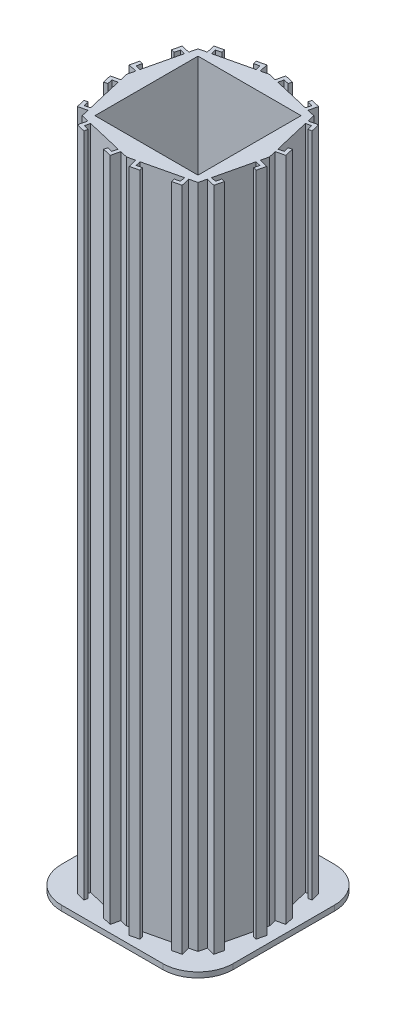
from build123d import *

# Parameters (mm, degrees)
SKETCH1_W           = 29.25
SKETCH1_H           = 29.25
BOSS_EXTRUDE1_DEPTH = 189
SKETCH2_W           = 28.75
SKETCH2_H           = 28.75
SKETCH2_W_2         = 26.35
SKETCH2_H_2         = 26.35
BOSS_EXTRUDE2_DEPTH = 10
SKETCH3_R           = 1.5
BOSS_EXTRUDE3_DEPTH = 1.5
SKETCH4_R           = 5
BOSS_EXTRUDE4_DEPTH = 2.5
FILLET1_R           = 2.5


with BuildPart() as part:
    # Sketch1 → Boss-Extrude1 (new body)
    with BuildSketch(Plane(origin=(0, 0, 0), x_dir=(1, 0, 0), z_dir=(0, 1, 0))):
        Polygon((-74.377733291, 45.028603114), (-74.878463495, 42.900030733), (-74.377733291, 40.771458351), (-76.811304338, 40.198979568), (-76.238825555, 37.76540852), (-75.265397136, 37.994400034), (-75.608884406, 39.454542662), (-74.148741777, 39.798029932), (-71.744330888, 29.577031533), (-73.204473516, 29.233544263), (-73.547960786, 30.693686892), (-74.521389205, 30.464695378), (-73.948910422, 28.031124331), (-71.515339374, 28.603603114), (-71.01460917, 26.475030733), (-68.886036789, 25.974300529), (-69.458515572, 23.540729481), (-67.024944525, 22.968250698), (-66.795953011, 23.941679117), (-68.25609564, 24.285166387), (-67.91260837, 25.745309015), (-57.691609971, 23.340898126), (-58.035097241, 21.880755497), (-59.495239869, 22.224242767), (-59.724231382, 21.250814348), (-57.290660335, 20.678335565), (-56.718181552, 23.111906612), (-54.58960917, 22.611176408), (-52.461036789, 23.111906612), (-51.888558005, 20.678335565), (-49.454986958, 21.250814348), (-49.683978471, 22.224242767), (-51.1441211, 21.880755497), (-51.48760837, 23.340898126), (-41.266609971, 25.745309015), (-40.923122701, 24.285166387), (-42.383265329, 23.941679117), (-42.154273816, 22.968250698), (-39.720702769, 23.540729481), (-40.293181552, 25.974300529), (-38.16460917, 26.475030733), (-37.663878966, 28.603603114), (-35.230307919, 28.031124331), (-34.657829136, 30.464695378), (-35.631257555, 30.693686892), (-35.974744824, 29.233544263), (-37.434887453, 29.577031533), (-35.030476563, 39.798029932), (-33.570333935, 39.454542662), (-33.913821205, 37.994400034), (-32.940392786, 37.76540852), (-32.367914002, 40.198979568), (-34.80148505, 40.771458351), (-34.300754846, 42.900030733), (-34.80148505, 45.028603114), (-32.367914002, 45.601081897), (-32.940392786, 48.034652945), (-33.913821205, 47.805661431), (-33.570333935, 46.345518803), (-35.030476563, 46.002031533), (-37.434887453, 56.223029932), (-35.974744824, 56.566517202), (-35.631257555, 55.106374574), (-34.657829136, 55.335366087), (-35.230307919, 57.768937134), (-37.663878966, 57.196458351), (-38.16460917, 59.325030733), (-40.293181552, 59.825760937), (-39.720702769, 62.259331984), (-42.154273816, 62.831810767), (-42.383265329, 61.858382348), (-40.923122701, 61.514895078), (-41.266609971, 60.05475245), (-51.48760837, 62.45916334), (-51.1441211, 63.919305968), (-49.683978471, 63.575818698), (-49.454986958, 64.549247117), (-51.888558005, 65.1217259), (-52.461036789, 62.688154853), (-54.58960917, 63.188885057), (-56.718181552, 62.688154853), (-57.290660335, 65.1217259), (-59.724231382, 64.549247117), (-59.495239869, 63.575818698), (-58.035097241, 63.919305968), (-57.691609971, 62.45916334), (-67.91260837, 60.05475245), (-68.25609564, 61.514895078), (-66.795953011, 61.858382348), (-67.024944525, 62.831810767), (-69.458515572, 62.259331984), (-68.886036789, 59.825760937), (-71.01460917, 59.325030733), (-71.515339374, 57.196458351), (-73.948910422, 57.768937134), (-74.521389205, 55.335366087), (-73.547960786, 55.106374574), (-73.204473516, 56.566517202), (-71.744330888, 56.223029932), (-74.148741777, 46.002031533), (-75.608884406, 46.345518803), (-75.265397136, 47.805661431), (-76.238825555, 48.034652945), (-76.811304338, 45.601081897), align=None)
        with Locations((-54.58960917, 42.900030733)):
            Rectangle(SKETCH1_W, SKETCH1_H, mode=Mode.SUBTRACT)
    extrude(amount=BOSS_EXTRUDE1_DEPTH)


with BuildPart() as body_2:
    # Sketch2 → Boss-Extrude2 (new body)
    with BuildSketch(Plane.XZ):
        with Locations((-54.58960917, -42.900030733)):
            Rectangle(SKETCH2_W, SKETCH2_H)
        with Locations((-54.58960917, -42.900030733)):
            Rectangle(SKETCH2_W_2, SKETCH2_H_2, mode=Mode.SUBTRACT)
    extrude(amount=-BOSS_EXTRUDE2_DEPTH)

    # Sketch3 → Boss-Extrude3 (add)
    with BuildSketch(Plane.XZ):
        with BuildLine():
            Line((-68.96460917, -67.275030733), (-40.21460917, -67.275030733))
            ThreePointArc((-40.21460917, -67.275030733), (-33.143541358, -64.346098544), (-30.21460917, -57.275030733))
            Line((-30.21460917, -57.275030733), (-30.21460917, -28.525030733))
            ThreePointArc((-30.21460917, -28.525030733), (-33.143541358, -21.453962921), (-40.21460917, -18.525030733))
            Line((-40.21460917, -18.525030733), (-68.96460917, -18.525030733))
            ThreePointArc((-68.96460917, -18.525030733), (-76.035676982, -21.453962921), (-78.96460917, -28.525030733))
            Line((-78.96460917, -28.525030733), (-78.96460917, -57.275030733))
            ThreePointArc((-78.96460917, -57.275030733), (-76.035676982, -64.346098544), (-68.96460917, -67.275030733))
        make_face()
        with Locations(Location((-54.664503297, -42.716454345, 0), (0, 0, 270))):
            Circle(SKETCH3_R, mode=Mode.SUBTRACT)
    extrude(amount=BOSS_EXTRUDE3_DEPTH)

    # Sketch4 → Boss-Extrude4 (add)
    with BuildSketch(Plane(origin=(0, 0, 0), x_dir=(1, 0, 0), z_dir=(0, 1, 0))):
        with Locations(Location((-54.664503297, 42.716454345, 0), (0, 0, 270))):
            Circle(SKETCH4_R)
        Polygon((-51.614503297, 42.716454345), (-53.139503297, 45.357831827), (-56.189503297, 45.357831827), (-57.714503297, 42.716454345), (-56.189503297, 40.075076863), (-53.139503297, 40.075076863), align=None, mode=Mode.SUBTRACT)
    extrude(amount=BOSS_EXTRUDE4_DEPTH)

    # Fillet1
    fillet1_edges = [body_2.edges().sort_by_distance(p)[0] for p in [
        (-54.664503297, 0, -47.716454345),
    ]]
    fillet(fillet1_edges, radius=FILLET1_R - 0.0001)  # a hair under: the kernel refuses the full size


solid = Compound([part.part, body_2.part])
